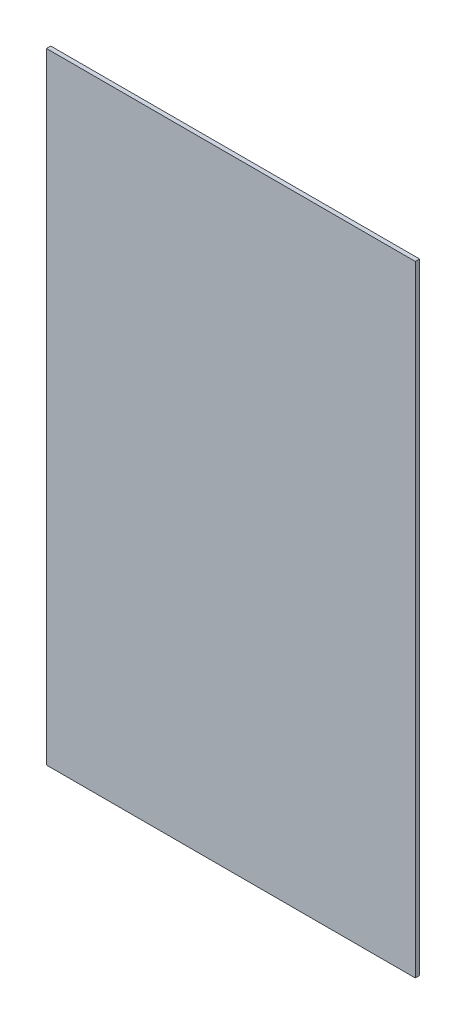
from build123d import *

# Parameters (mm, degrees)
SKETCH_1_W      = 518
SKETCH_1_H      = 871.6
EXTRUDE_1_DEPTH = 6


with BuildPart() as part:
    # Эскиз1 → Бобышка-Вытянуть1 (new body)
    with BuildSketch(Plane.XY):
        with Locations((-259, 0)):
            Rectangle(SKETCH_1_W, SKETCH_1_H)
    extrude(amount=-EXTRUDE_1_DEPTH)


solid = part.part
